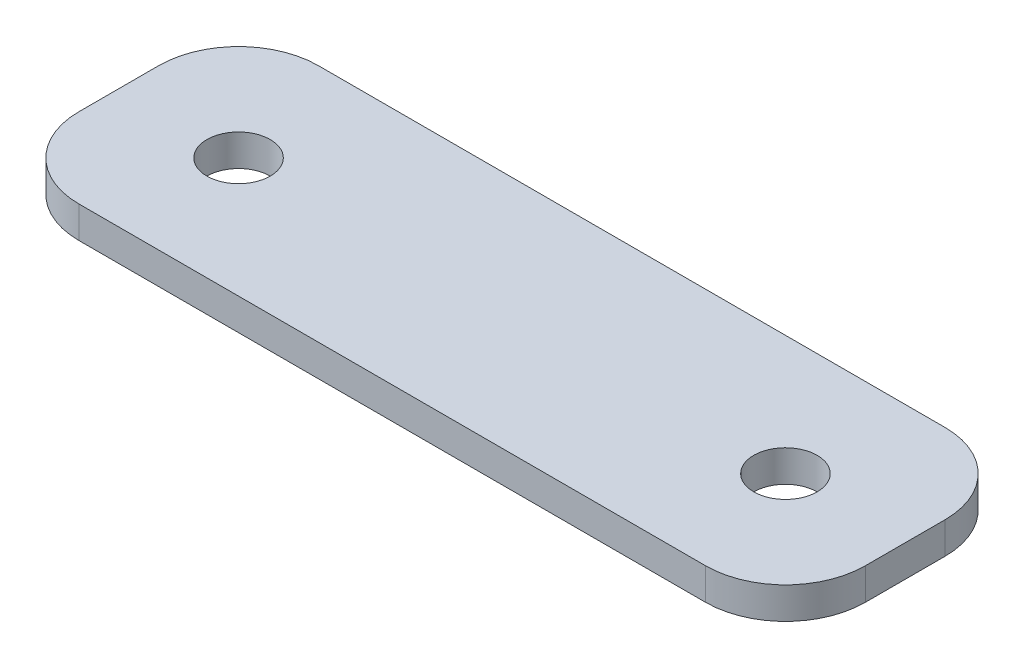
from build123d import *

# Parameters (mm, degrees)
SKETCH1_W           = 39.4
SKETCH1_H           = 12
SKETCH1_R           = 1.5875
BOSS_EXTRUDE1_DEPTH = 0.79375
FILLET1_R           = 4


with BuildPart() as part:
    # Sketch1 → Boss-Extrude1 (new, symmetric)
    with BuildSketch(Plane(origin=(0, 0, 0), x_dir=(1, 0, 0), z_dir=(0, 1, 0))):
        Rectangle(SKETCH1_W, SKETCH1_H)
        with Locations((-13.7, 0)):
            Circle(SKETCH1_R, mode=Mode.SUBTRACT)
        with Locations((13.7, 0)):
            Circle(SKETCH1_R, mode=Mode.SUBTRACT)
    extrude(amount=BOSS_EXTRUDE1_DEPTH, both=True)

    # Fillet1
    fillet1_edges = [part.edges().sort_by_distance(p)[0] for p in [
        (19.7, 0, 6),
        (19.7, 0, -6),
        (-19.7, 0, 6),
        (-19.7, 0, -6),
    ]]
    fillet(fillet1_edges, radius=FILLET1_R)


solid = part.part
